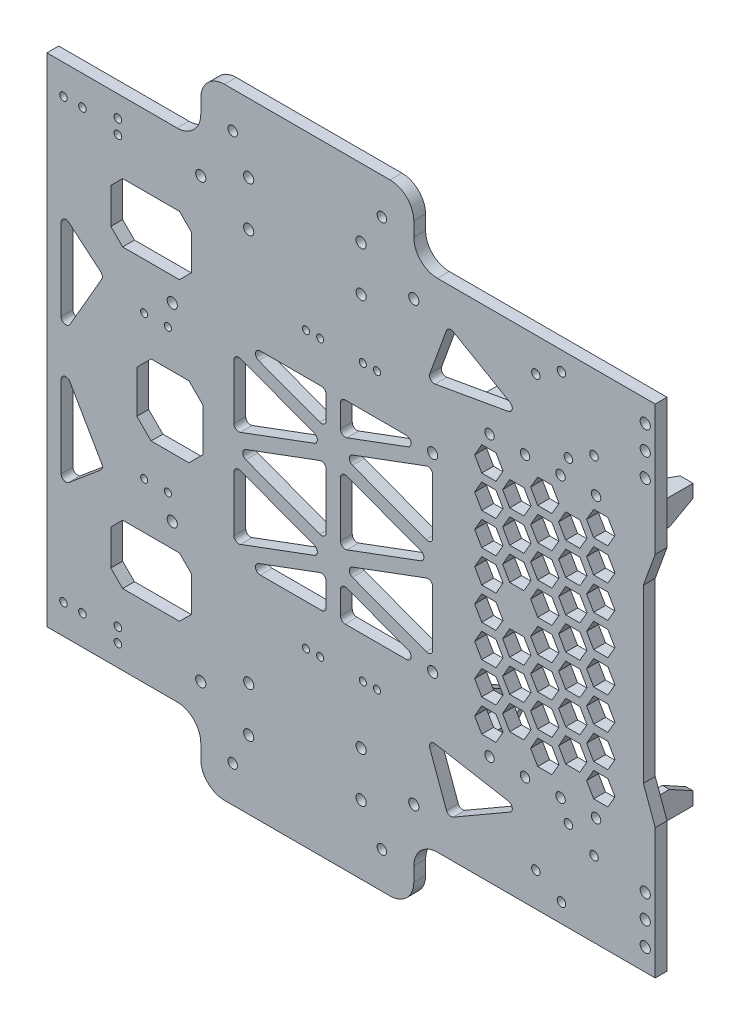
from build123d import *
from OCP.BRepFilletAPI import BRepFilletAPI_MakeChamfer

# Parameters (mm, degrees)
EXTRUDE_1_DEPTH              = 5
EXTRUDE_2_DEPTH              = 20
CHAMFER_2_SIZE               = 6
CHAMFER_2_SIZE2              = 3.19025659
CUT_EXTRUDE_3_DEPTH          = 10
CUT_EXTRUDE_4_DEPTH          = 10
CHAMFER_2_OF_MIRROR_1_SIZE   = 6
CHAMFER_2_OF_MIRROR_1_SIZE2  = 3.19025659
SKETCH_29_R                  = 2
CUT_EXTRUDE_12_DEPTH         = 10
CUT_EXTRUDE_5_DEPTH          = 5
OTHER_1_DEPTH                = 5
CUT_EXTRUDE_6_DEPTH          = 5
FILLET_2_R                   = 2
SKETCH_12_W                  = 10
SKETCH_12_H                  = 210
EXTRUDE_3_DEPTH              = 5
HOLE_WIZARD_M3_1_D           = 3.2
HOLE_WIZARD_M3_1_CBORE_D     = 5.9
HOLE_WIZARD_M3_1_CBORE_DEPTH = 1.6
SKETCH_10_R                  = 1.6
SKETCH_10_R_2                = 1.8
SKETCH_10_R_3                = 1.5
CUT_EXTRUDE_7_DEPTH          = 186.636742053
HOLE_WIZARD_2_D              = 4.3
HOLE_WIZARD_2_CSINK_D        = 7.5
HOLE_WIZARD_2_CSINK_ANGLE    = 90
HOLE_WIZARD_3_D              = 4.3
HOLE_WIZARD_3_CSINK_D        = 8
HOLE_WIZARD_3_CSINK_ANGLE    = 90
HOLE_WIZARD_1_D              = 4.3
HOLE_WIZARD_1_DEPTH          = 19
HOLE_WIZARD_1_CSINK_D        = 8
HOLE_WIZARD_1_CSINK_ANGLE    = 90
HOLE_WIZARD_1_TIP            = 1.291850331
SKETCH_14_R                  = 2
CUT_EXTRUDE_9_DEPTH          = 10
CUT_EXTRUDE_13_DEPTH         = 10
CUT_EXTRUDE_8_DEPTH          = 186.636742053
CUT_EXTRUDE_11_DEPTH         = 10
CUT_EXTRUDE_14_DEPTH         = 10
HOLE_WIZARD_4_D              = 4.3
HOLE_WIZARD_4_CSINK_D        = 5
HOLE_WIZARD_4_CSINK_ANGLE    = 90
SKETCH_36_W                  = 5
SKETCH_36_H                  = 100
CUT_EXTRUDE_15_DEPTH         = 10
CHAMFER_1_SIZE               = 13.737387097
CHAMFER_1_SIZE_2             = 5


# Read off the part's stored shape, not the designer's step: 镜向2, 填充阵列1
with BuildPart() as part:
    # 草图1 → 凸台-拉伸1 (new body)
    with BuildSketch(Plane.XY):
        with BuildLine():
            Line((-127, 105), (-127, 0))
            Line((-127, 0), (-127, -105))
            Line((-127, -105), (-126.91, -105))
            Line((-126.91, -105), (-72, -105))
            ThreePointArc((-72, -105), (-64.928932188, -107.928932188), (-62, -115))
            Line((-62, -115), (-62, -121))
            ThreePointArc((-62, -121), (-59.071067812, -128.071067812), (-52, -131))
            Line((-52, -131), (18, -131))
            ThreePointArc((18, -131), (25.071067812, -128.071067812), (28, -121))
            Line((28, -121), (28, -115))
            ThreePointArc((28, -115), (30.928932188, -107.928932188), (38, -105))
            Line((38, -105), (120, -105))
            ThreePointArc((120, -105), (127.071067812, -102.071067812), (130, -95))
            Line((130, -95), (130, 95))
            ThreePointArc((130, 95), (127.071067812, 102.071067812), (120, 105))
            Line((120, 105), (38, 105))
            ThreePointArc((38, 105), (30.928932188, 107.928932188), (28, 115))
            Line((28, 115), (28, 121))
            ThreePointArc((28, 121), (25.071067812, 128.071067812), (18, 131))
            Line((18, 131), (-52, 131))
            ThreePointArc((-52, 131), (-59.071067812, 128.071067812), (-62, 121))
            Line((-62, 121), (-62, 115))
            ThreePointArc((-62, 115), (-64.928932188, 107.928932188), (-72, 105))
            Line((-72, 105), (-126.91, 105))
            Line((-126.91, 105), (-127, 105))
        make_face()
    extrude(amount=EXTRUDE_1_DEPTH)

    # 草图4 → 凸台-拉伸2 (add)
    with BuildSketch(Plane(origin=(0, 0, 0), x_dir=(-1, 0, 0), z_dir=(0, 0, -1))):
        Polygon((-44, -48), (-44, -59), (-55, -59), (-55, -56), (-47, -56), (-47, -48), align=None)
    extrude_2 = extrude(amount=EXTRUDE_2_DEPTH)

    # 倒角2: one chamfer whose edges measure the first distance from different faces: ONE call of the kernel's chamfer builder (chamfer() names one face for all edges)
    chamfer_2_edges_1 = [part.edges().sort_by_distance(p)[0] for p in [
        (49.5, -59, 0),
    ]]
    chamfer_2_side_1 = [part.faces().sort_by_distance(p)[0] for p in [
        (49.5, -59, -10),
    ]]
    chamfer_2_edges_2 = [part.edges().sort_by_distance(p)[0] for p in [
        (44, -53.5, 0),
    ]]
    chamfer_2_side_2 = [part.faces().sort_by_distance(p)[0] for p in [
        (44, -53.5, -10),
    ]]
    chamfer_2 = BRepFilletAPI_MakeChamfer(part.part.solid().wrapped)
    for e in chamfer_2_edges_1:
        chamfer_2.Add(CHAMFER_2_SIZE, CHAMFER_2_SIZE2, e.wrapped, chamfer_2_side_1[0].wrapped)  # the first distance lies on this face
    for e in chamfer_2_edges_2:
        chamfer_2.Add(CHAMFER_2_SIZE, CHAMFER_2_SIZE2, e.wrapped, chamfer_2_side_2[0].wrapped)  # the first distance lies on this face
    add(Compound.cast(chamfer_2.Shape()), mode=Mode.REPLACE)

    # 草图5 → 切除-拉伸3 (cut)
    with BuildSketch(Plane.XZ.offset(59)):
        Polygon((55, -10), (49.5, -20), (55, -20), align=None)
    cut_extrude_3 = extrude(amount=-CUT_EXTRUDE_3_DEPTH, mode=Mode.SUBTRACT)

    # 草图6 → 切除-拉伸4 (cut)
    with BuildSketch(Plane.ZY.offset(-44)):
        Polygon((-20, -53.5), (-10, -48), (-20, -48), align=None)
    cut_extrude_4 = extrude(amount=-CUT_EXTRUDE_4_DEPTH, mode=Mode.SUBTRACT)

    # 镜向1: 凸台-拉伸2, 切除-拉伸3, 切除-拉伸4 across plane
    add(extrude_2.mirror(Plane(origin=(82.5, 0, 0), x_dir=(0, 0, 1), z_dir=(1, 0, 0))))
    add(cut_extrude_3.mirror(Plane(origin=(82.5, 0, 0), x_dir=(0, 0, 1), z_dir=(1, 0, 0))), mode=Mode.SUBTRACT)
    add(cut_extrude_4.mirror(Plane(origin=(82.5, 0, 0), x_dir=(0, 0, 1), z_dir=(1, 0, 0))), mode=Mode.SUBTRACT)

    # 倒角2 of 镜向1: one chamfer whose edges measure the first distance from different faces: ONE call of the kernel's chamfer builder (chamfer() names one face for all edges)
    chamfer_2_of_mirror_1_edges_1 = [part.edges().sort_by_distance(p)[0] for p in [
        (115.5, -59, 0),
    ]]
    chamfer_2_of_mirror_1_side_1 = [part.faces().sort_by_distance(p)[0] for p in [
        (115.5, -59, -10),
    ]]
    chamfer_2_of_mirror_1_edges_2 = [part.edges().sort_by_distance(p)[0] for p in [
        (121, -53.5, 0),
    ]]
    chamfer_2_of_mirror_1_side_2 = [part.faces().sort_by_distance(p)[0] for p in [
        (121, -53.5, -10),
    ]]
    chamfer_2_of_mirror_1 = BRepFilletAPI_MakeChamfer(part.part.solid().wrapped)
    for e in chamfer_2_of_mirror_1_edges_1:
        chamfer_2_of_mirror_1.Add(CHAMFER_2_OF_MIRROR_1_SIZE, CHAMFER_2_OF_MIRROR_1_SIZE2, e.wrapped, chamfer_2_of_mirror_1_side_1[0].wrapped)  # the first distance lies on this face
    for e in chamfer_2_of_mirror_1_edges_2:
        chamfer_2_of_mirror_1.Add(CHAMFER_2_OF_MIRROR_1_SIZE, CHAMFER_2_OF_MIRROR_1_SIZE2, e.wrapped, chamfer_2_of_mirror_1_side_2[0].wrapped)  # the first distance lies on this face
    add(Compound.cast(chamfer_2_of_mirror_1.Shape()), mode=Mode.REPLACE)

    # 镜向2: part across plane


with BuildPart() as part_1:
    add(part.part)
    add(part.part.mirror(Plane.ZX))

    # 草图29 → 切除-拉伸12 (cut)
    with BuildSketch(Plane(origin=(0, 0, 0), x_dir=(-1, 0, 0), z_dir=(0, 0, -1))):
        with Locations((-75, -59)):
            Circle(SKETCH_29_R)
        with Locations((-60, -59)):
            Circle(SKETCH_29_R)
        with Locations(Location((-105, -59, 0), (0, 0, 180))):
            Circle(SKETCH_29_R)
        with Locations(Location((-90, -59, 0), (0, 0, 180))):
            Circle(SKETCH_29_R)
        with Locations(Location((-60, 59, 0), (0, 0, 180))):
            Circle(SKETCH_29_R)
        with Locations(Location((-75, 59, 0), (0, 0, 180))):
            Circle(SKETCH_29_R)
        with Locations((-90, 59)):
            Circle(SKETCH_29_R)
        with Locations((-105, 59)):
            Circle(SKETCH_29_R)
    extrude(amount=-CUT_EXTRUDE_12_DEPTH, mode=Mode.SUBTRACT)

    # 草图7 → 切除-拉伸5 (cut)
    with BuildSketch(Plane(origin=(0, 0, 0), x_dir=(-1, 0, 0), z_dir=(0, 0, -1))):
        Polygon((-104, 43.107695155), (-101, 48.303847577), (-104, 53.5), (-110, 53.5), (-113, 48.303847577), (-110, 43.107695155), align=None)
    extrude(amount=-CUT_EXTRUDE_5_DEPTH, mode=Mode.SUBTRACT)

    # 填充阵列1 outline → 填充阵列1 (cut)
    with BuildSketch(Plane.XY):
        Polygon((53.715012953, 48.303847577), (56.715012953, 43.107695155), (62.715012953, 43.107695155), (65.715012953, 48.303847577), (62.715012953, 53.5), (56.715012953, 53.5), align=None)
        Polygon((77.357506477, 48.303847577), (80.357506477, 43.107695155), (86.357506477, 43.107695155), (89.357506477, 48.303847577), (86.357506477, 53.5), (80.357506477, 53.5), align=None)
        Polygon((92.178753238, 22.632695155), (98.178753238, 22.632695155), (101.178753238, 27.828847577), (98.178753238, 33.025), (92.178753238, 33.025), (89.178753238, 27.828847577), align=None)
        Polygon((80.357506477, 2.157695155), (86.357506477, 2.157695155), (89.357506477, 7.353847577), (86.357506477, 12.55), (80.357506477, 12.55), (77.357506477, 7.353847577), align=None)
        Polygon((56.715012953, -38.792304845), (62.715012953, -38.792304845), (65.715012953, -33.596152423), (62.715012953, -28.4), (56.715012953, -28.4), (53.715012953, -33.596152423), align=None)
        Polygon((68.536259715, -18.317304845), (74.536259715, -18.317304845), (77.536259715, -13.121152423), (74.536259715, -7.925), (68.536259715, -7.925), (65.536259715, -13.121152423), align=None)
        Polygon((74.536259715, 22.632695155), (77.536259715, 27.828847577), (74.536259715, 33.025), (68.536259715, 33.025), (65.536259715, 27.828847577), (68.536259715, 22.632695155), align=None)
        Polygon((110, -38.792304845), (113, -33.596152423), (110, -28.4), (104, -28.4), (101, -33.596152423), (104, -38.792304845), align=None)
        Polygon((98.178753238, -18.317304845), (101.178753238, -13.121152423), (98.178753238, -7.925), (92.178753238, -7.925), (89.178753238, -13.121152423), (92.178753238, -18.317304845), align=None)
        Polygon((77.357506477, -47.246152423), (80.357506477, -52.442304845), (86.357506477, -52.442304845), (89.357506477, -47.246152423), (86.357506477, -42.05), (80.357506477, -42.05), align=None)
        Polygon((101, -47.246152423), (104, -52.442304845), (110, -52.442304845), (113, -47.246152423), (110, -42.05), (104, -42.05), align=None)
        Polygon((53.715012953, -47.246152423), (56.715012953, -52.442304845), (62.715012953, -52.442304845), (65.715012953, -47.246152423), (62.715012953, -42.05), (56.715012953, -42.05), align=None)
        Polygon((92.178753238, -31.967304845), (98.178753238, -31.967304845), (101.178753238, -26.771152423), (98.178753238, -21.575), (92.178753238, -21.575), (89.178753238, -26.771152423), align=None)
        Polygon((104, -11.492304845), (110, -11.492304845), (113, -6.296152423), (110, -1.1), (104, -1.1), (101, -6.296152423), align=None)
        Polygon((62.715012953, -11.492304845), (65.715012953, -6.296152423), (62.715012953, -1.1), (56.715012953, -1.1), (53.715012953, -6.296152423), (56.715012953, -11.492304845), align=None)
        Polygon((74.536259715, -31.967304845), (77.536259715, -26.771152423), (74.536259715, -21.575), (68.536259715, -21.575), (65.536259715, -26.771152423), (68.536259715, -31.967304845), align=None)
        Polygon((89.178753238, -40.421152423), (92.178753238, -45.617304845), (98.178753238, -45.617304845), (101.178753238, -40.421152423), (98.178753238, -35.225), (92.178753238, -35.225), align=None)
        Polygon((65.536259715, -40.421152423), (68.536259715, -45.617304845), (74.536259715, -45.617304845), (77.536259715, -40.421152423), (74.536259715, -35.225), (68.536259715, -35.225), align=None)
        Polygon((104, -25.142304845), (110, -25.142304845), (113, -19.946152423), (110, -14.75), (104, -14.75), (101, -19.946152423), align=None)
        Polygon((62.715012953, 15.807695155), (65.715012953, 21.003847577), (62.715012953, 26.2), (56.715012953, 26.2), (53.715012953, 21.003847577), (56.715012953, 15.807695155), align=None)
        Polygon((86.357506477, -25.142304845), (89.357506477, -19.946152423), (86.357506477, -14.75), (80.357506477, -14.75), (77.357506477, -19.946152423), (80.357506477, -25.142304845), align=None)
        Polygon((74.536259715, 8.982695155), (77.536259715, 14.178847577), (74.536259715, 19.375), (68.536259715, 19.375), (65.536259715, 14.178847577), (68.536259715, 8.982695155), align=None)
        Polygon((62.715012953, 29.457695155), (65.715012953, 34.653847577), (62.715012953, 39.85), (56.715012953, 39.85), (53.715012953, 34.653847577), (56.715012953, 29.457695155), align=None)
        Polygon((86.357506477, -11.492304845), (89.357506477, -6.296152423), (86.357506477, -1.1), (80.357506477, -1.1), (77.357506477, -6.296152423), (80.357506477, -11.492304845), align=None)
        Polygon((89.178753238, 14.178847577), (92.178753238, 8.982695155), (98.178753238, 8.982695155), (101.178753238, 14.178847577), (98.178753238, 19.375), (92.178753238, 19.375), align=None)
        Polygon((80.357506477, 29.457695155), (86.357506477, 29.457695155), (89.357506477, 34.653847577), (86.357506477, 39.85), (80.357506477, 39.85), (77.357506477, 34.653847577), align=None)
        Polygon((53.715012953, 7.353847577), (56.715012953, 2.157695155), (62.715012953, 2.157695155), (65.715012953, 7.353847577), (62.715012953, 12.55), (56.715012953, 12.55), align=None)
        Polygon((101, 7.353847577), (104, 2.157695155), (110, 2.157695155), (113, 7.353847577), (110, 12.55), (104, 12.55), align=None)
        Polygon((86.357506477, -38.792304845), (89.357506477, -33.596152423), (86.357506477, -28.4), (80.357506477, -28.4), (77.357506477, -33.596152423), (80.357506477, -38.792304845), align=None)
        Polygon((77.357506477, 21.003847577), (80.357506477, 15.807695155), (86.357506477, 15.807695155), (89.357506477, 21.003847577), (86.357506477, 26.2), (80.357506477, 26.2), align=None)
        Polygon((101, 21.003847577), (104, 15.807695155), (110, 15.807695155), (113, 21.003847577), (110, 26.2), (104, 26.2), align=None)
        Polygon((92.178753238, 36.282695155), (98.178753238, 36.282695155), (101.178753238, 41.478847577), (98.178753238, 46.675), (92.178753238, 46.675), (89.178753238, 41.478847577), align=None)
        Polygon((56.715012953, -25.142304845), (62.715012953, -25.142304845), (65.715012953, -19.946152423), (62.715012953, -14.75), (56.715012953, -14.75), (53.715012953, -19.946152423), align=None)
        Polygon((74.536259715, 36.282695155), (77.536259715, 41.478847577), (74.536259715, 46.675), (68.536259715, 46.675), (65.536259715, 41.478847577), (68.536259715, 36.282695155), align=None)
        Polygon((98.178753238, -4.667304845), (101.178753238, 0.528847577), (98.178753238, 5.725), (92.178753238, 5.725), (89.178753238, 0.528847577), (92.178753238, -4.667304845), align=None)
        Polygon((104, 29.457695155), (110, 29.457695155), (113, 34.653847577), (110, 39.85), (104, 39.85), (101, 34.653847577), align=None)
    extrude(amount=OTHER_1_DEPTH, mode=Mode.SUBTRACT)

    # 草图9 → 切除-拉伸6 (cut)
    with BuildSketch(Plane(origin=(0, 0, 0), x_dir=(-1, 0, 0), z_dir=(0, 0, -1))):
        Polygon((3, 20.5), (-36, 35), (-36, 6), align=None)
        Polygon((3, 41), (-36, 41), (3, 26.5), align=None)
        Polygon((3, -14.5), (3, 14.5), (-36, 0), align=None)
        Polygon((-36, -6), (-36, -35), (3, -20.5), align=None)
        Polygon((-36, -41), (3, -41), (3, -26.5), align=None)
        Polygon((48, 41), (9, 41), (9, 26.5), align=None)
        Polygon((48, 6), (48, 35), (9, 20.5), align=None)
        Polygon((9, -26.5), (9, -41), (48, -41), align=None)
        Polygon((9, -20.5), (48, -35), (48, -6), align=None)
        Polygon((9, 14.5), (9, -14.5), (48, 0), align=None)
    extrude(amount=-CUT_EXTRUDE_6_DEPTH, mode=Mode.SUBTRACT)

    # 圆角2
    fillet_2_edges = [part_1.edges().sort_by_distance(p)[0] for p in [
        (-48, 35, 2.5),
        (-48, 6, 2.5),
        (-9, 20.5, 2.5),
        (-9, -41, 2.5),
        (-9, -26.5, 2.5),
        (-48, -41, 2.5),
        (36, -35, 2.5),
        (36, -6, 2.5),
        (-3, -20.5, 2.5),
        (-3, -41, 2.5),
        (36, -41, 2.5),
        (-3, -26.5, 2.5),
        (-48, -35, 2.5),
        (-9, -20.5, 2.5),
        (-48, -6, 2.5),
        (-9, 14.5, 2.5),
        (-48, 0, 2.5),
        (-9, -14.5, 2.5),
        (-3, 20.5, 2.5),
        (36, 6, 2.5),
        (36, 35, 2.5),
        (-3, 26.5, 2.5),
        (36, 41, 2.5),
        (-3, 41, 2.5),
        (-9, 41, 2.5),
        (-48, 41, 2.5),
        (-9, 26.5, 2.5),
        (-3, -14.5, 2.5),
        (36, 0, 2.5),
        (-3, 14.5, 2.5),
    ]]
    fillet(fillet_2_edges, radius=FILLET_2_R)

    # 草图12 → 凸台-拉伸3 (add)
    with BuildSketch(Plane(origin=(0, 0, 0), x_dir=(-1, 0, 0), z_dir=(0, 0, -1))):
        with Locations((-125, 0)):
            Rectangle(SKETCH_12_W, SKETCH_12_H)
    extrude(amount=-EXTRUDE_3_DEPTH)

    # M3 六角头螺栓的柱形沉头孔1 (through all)
    with Locations(Plane(origin=(-124.363861944, -131.010130877, -4.2), x_dir=(0, 1, 0), z_dir=(0, 0, -1))):
        with Locations((221.010130877, 27.363861944), (227.010130877, 27.363861944)):
            CounterBoreHole(HOLE_WIZARD_M3_1_D / 2, HOLE_WIZARD_M3_1_CBORE_D / 2, HOLE_WIZARD_M3_1_CBORE_DEPTH)

    # 草图10 → 切除-拉伸7 (cut, through all)
    with BuildSketch(Plane(origin=(0, 0, 0), x_dir=(-1, 0, 0), z_dir=(0, 0, -1))):
        with Locations((112, 92.5)):
            Circle(SKETCH_10_R)
        with Locations((120, 92.5)):
            Circle(SKETCH_10_R)
        with Locations(Location((120, -92.5, 0), (0, 0, 180))):
            Circle(SKETCH_10_R)
        with Locations(Location((112, -92.5, 0), (0, 0, 180))):
            Circle(SKETCH_10_R)
        with Locations((-104.142304845, 73.184301396)):
            Circle(SKETCH_10_R_2)
        with Locations((-93.316987298, 66.934301396)):
            Circle(SKETCH_10_R_2)
        with Locations((-90.392304845, 97)):
            Circle(SKETCH_10_R_2)
        with Locations((-79.566987298, 90.75)):
            Circle(SKETCH_10_R_2)
        with Locations(Location((-79.566987298, -90.75, 0), (0, 0, 180))):
            Circle(SKETCH_10_R_2)
        with Locations(Location((-90.392304845, -97, 0), (0, 0, 180))):
            Circle(SKETCH_10_R_2)
        with Locations(Location((-93.316987298, -66.934301396, 0), (0, 0, 180))):
            Circle(SKETCH_10_R_2)
        with Locations(Location((-104.142304845, -73.184301396, 0), (0, 0, 180))):
            Circle(SKETCH_10_R_2)
        with Locations((-12.457142988, 58.25)):
            Circle(SKETCH_10_R_3)
        with Locations((-6.457142988, 58.25)):
            Circle(SKETCH_10_R_3)
        with Locations((11.542857012, 58.25)):
            Circle(SKETCH_10_R_3)
        with Locations((17.542857012, 58.25)):
            Circle(SKETCH_10_R_3)
        with Locations(Location((17.542857012, -58.25, 0), (0, 0, 180))):
            Circle(SKETCH_10_R_3)
        with Locations(Location((11.542857012, -58.25, 0), (0, 0, 180))):
            Circle(SKETCH_10_R_3)
        with Locations(Location((-6.457142988, -58.25, 0), (0, 0, 180))):
            Circle(SKETCH_10_R_3)
        with Locations(Location((-12.457142988, -58.25, 0), (0, 0, 180))):
            Circle(SKETCH_10_R_3)
        with Locations(Location((97, 96, 0), (0, 0, 90))):
            Circle(SKETCH_10_R)
        with Locations(Location((97, 90, 0), (0, 0, 90))):
            Circle(SKETCH_10_R)
        with Locations(Location((97, -90, 0), (0, 0, 180))):
            Circle(SKETCH_10_R)
        with Locations(Location((97, -96, 0), (0, 0, 180))):
            Circle(SKETCH_10_R)
        with Locations((75.896950208, 30.3)):
            Circle(SKETCH_10_R_3)
        with Locations((85.896950208, 30.3)):
            Circle(SKETCH_10_R_3)
        with Locations(Location((85.896950208, -30.3, 0), (0, 0, 180))):
            Circle(SKETCH_10_R_3)
        with Locations(Location((75.896950208, -30.3, 0), (0, 0, 180))):
            Circle(SKETCH_10_R_3)
    extrude(amount=-CUT_EXTRUDE_7_DEPTH, mode=Mode.SUBTRACT)

    # 打孔尺寸(%根据十字)槽半沉头木螺钉的类型2 (through all)
    with Locations(Plane(origin=(-40.491378875, -131.010130877, 55.5), x_dir=(0, -1, 0), z_dir=(0, 0, 1))):
        with Locations((-171.010130877, 76.446187472), (-91.010130877, 76.446187472), (-171.010130877, -33.553812528), (-91.010130877, -33.553812528)):
            CounterSinkHole(HOLE_WIZARD_2_D / 2, HOLE_WIZARD_2_CSINK_D / 2, counter_sink_angle=HOLE_WIZARD_2_CSINK_ANGLE)

    # 打孔尺寸(%根据十字)槽半沉头木螺钉的类型3 (through all)
    with Locations(Plane(origin=(-40.491378875, -131.010130877, 55.5), x_dir=(0, -1, 0), z_dir=(0, 0, 1))):
        with Locations((-38.510130877, 68.491378875), (-38.510130877, -21.508621125), (-223.510130877, -21.508621125), (-223.510130877, 68.491378875)):
            CounterSinkHole(HOLE_WIZARD_3_D / 2, HOLE_WIZARD_3_CSINK_D / 2, counter_sink_angle=HOLE_WIZARD_3_CSINK_ANGLE)

    # 打孔尺寸(%根据十字)槽沉头木螺钉的类型1
    with Locations(Plane(origin=(-40.491378875, -131.010130877, -7.000000001), x_dir=(0, 1, 0), z_dir=(0, 0, -1))):
        with Locations((35.241437657, 166.27295648), (45.241437657, 166.27295648), (55.241437657, 166.27295648), (206.778824098, 166.27295648), (216.778824098, 166.27295648), (226.778824098, 166.27295648)):
            CounterSinkHole(HOLE_WIZARD_1_D / 2, HOLE_WIZARD_1_CSINK_D / 2, depth=HOLE_WIZARD_1_DEPTH, counter_sink_angle=HOLE_WIZARD_1_CSINK_ANGLE)
            with Locations((0, 0, -(HOLE_WIZARD_1_DEPTH + HOLE_WIZARD_1_TIP / 2))):  # 118° drill point
                Cone(0, HOLE_WIZARD_1_D / 2, HOLE_WIZARD_1_TIP, mode=Mode.SUBTRACT)

    # 草图14 → 切除-拉伸9 (cut)
    with BuildSketch(Plane.XY.offset(5)):
        with Locations((14.5, -115.68)):
            Circle(SKETCH_14_R)
        with Locations((-48.5, -115.68)):
            Circle(SKETCH_14_R)
        with Locations((-48.5, 115.68)):
            Circle(SKETCH_14_R)
        with Locations((14.5, 115.68)):
            Circle(SKETCH_14_R)
    extrude(amount=-CUT_EXTRUDE_9_DEPTH, mode=Mode.SUBTRACT)

    # 草图31 → 切除-拉伸13 (cut)
    with BuildSketch(Plane(origin=(0, 0, 0), x_dir=(-1, 0, 0), z_dir=(0, 0, -1))):
        with BuildLine():
            Line((103.839099631, -33.759449727), (117.267949192, -10.5))
            ThreePointArc((117.267949192, -10.5), (119.51763809, -9.568148347), (121, -11.5))
            Line((121, -11.5), (121, -46.027592441))
            ThreePointArc((121, -46.027592441), (119.845236523, -47.840208015), (117.714424781, -47.559681328))
            Line((117.714424781, -47.559681328), (104.285575219, -36.291538614))
            ThreePointArc((104.285575219, -36.291538614), (103.601534933, -35.106746083), (103.839099631, -33.759449727))
        make_face()
        with BuildLine():
            Line((121, 11.5), (121, 46.027592441))
            ThreePointArc((121, 46.027592441), (119.845236523, 47.840208015), (117.714424781, 47.559681328))
            Line((117.714424781, 47.559681328), (104.285575219, 36.291538614))
            ThreePointArc((104.285575219, 36.291538614), (103.601534933, 35.106746083), (103.839099631, 33.759449727))
            Line((103.839099631, 33.759449727), (117.267949192, 10.5))
            ThreePointArc((117.267949192, 10.5), (119.51763809, 9.568148347), (121, 11.5))
        make_face()
    extrude(amount=-CUT_EXTRUDE_13_DEPTH, mode=Mode.SUBTRACT)

    # 草图11 → 切除-拉伸8 (cut, through all)
    with BuildSketch(Plane(origin=(0, 0, 0), x_dir=(-1, 0, 0), z_dir=(0, 0, -1))):
        Polygon((71, -75), (95, -75), (100, -70), (100, -55), (95, -50), (71, -50), (66, -55), (66, -70), align=None)
        Polygon((95, 75), (100, 70), (100, 55), (95, 50), (71, 50), (66, 55), (66, 70), (71, 75), align=None)
    extrude(amount=-CUT_EXTRUDE_8_DEPTH, mode=Mode.SUBTRACT)

    # 草图18 → 切除-拉伸11 (cut)
    with BuildSketch(Plane.XY.offset(5)):
        Polygon((-89, 9), (-83, 15), (-67, 15), (-61, 9), (-61, -9), (-67, -15), (-83, -15), (-89, -9), align=None)
    extrude(amount=-CUT_EXTRUDE_11_DEPTH, mode=Mode.SUBTRACT)

    # 草图32 → 切除-拉伸14 (cut)
    with BuildSketch(Plane.XY.offset(5)):
        with BuildLine():
            Line((68.615081359, -74.977511711), (44.659546159, -88.808246407))
            ThreePointArc((44.659546159, -88.808246407), (42.975505873, -88.955580841), (41.780160918, -87.760235886))
            Line((41.780160918, -87.760235886), (34.758112882, -68.467317469))
            ThreePointArc((34.758112882, -68.467317469), (35.105409237, -66.497701963), (36.984794479, -65.813661676))
            Line((36.984794479, -65.813661676), (67.962377714, -71.275845398))
            ThreePointArc((67.962377714, -71.275845398), (69.584696865, -72.898164549), (68.615081359, -74.977511711))
        make_face()
        with BuildLine():
            Line((41.780160918, 87.760235886), (34.758112882, 68.467317469))
            ThreePointArc((34.758112882, 68.467317469), (35.105409237, 66.497701963), (36.984794479, 65.813661676))
            Line((36.984794479, 65.813661676), (67.962377714, 71.275845398))
            ThreePointArc((67.962377714, 71.275845398), (69.584696865, 72.898164549), (68.615081359, 74.977511711))
            Line((68.615081359, 74.977511711), (44.659546159, 88.808246407))
            ThreePointArc((44.659546159, 88.808246407), (42.975505873, 88.955580841), (41.780160918, 87.760235886))
        make_face()
    extrude(amount=-CUT_EXTRUDE_14_DEPTH, mode=Mode.SUBTRACT)

    # 打孔尺寸(%根据十字)槽半沉头木螺钉的类型4 (through all)
    with Locations(Plane(origin=(-124.363861944, -131.010130877, -5), x_dir=(0, 1, 0), z_dir=(0, 0, -1))):
        with Locations((233.010130877, 130.113861944), (214.010130877, 130.113861944), (214.010130877, 82.613861944), (233.010130877, 82.613861944), (48.010130877, 82.613861944), (29.010130877, 82.613861944), (29.010130877, 130.113861944), (48.010130877, 130.113861944)):
            CounterSinkHole(HOLE_WIZARD_4_D / 2, HOLE_WIZARD_4_CSINK_D / 2, counter_sink_angle=HOLE_WIZARD_4_CSINK_ANGLE)

    # 草图36 → 切除-拉伸15 (cut)
    with BuildSketch(Plane(origin=(0, 0, 0), x_dir=(-1, 0, 0), z_dir=(0, 0, -1))):
        with Locations((-127.5, 0)):
            Rectangle(SKETCH_36_W, SKETCH_36_H)
    extrude(amount=-CUT_EXTRUDE_15_DEPTH, mode=Mode.SUBTRACT)

    # 倒角1
    chamfer_1_edges_1 = [part_1.edges().sort_by_distance(p)[0] for p in [
        (125, -50, 2.5),
    ]]
    chamfer_1_side_1 = [part_1.faces().sort_by_distance(p)[0] for p in [
        (125, -49.9, 2.5),
    ]]
    chamfer_1_edges_2 = [part_1.edges().sort_by_distance(p)[0] for p in [
        (125, 50, 2.5),
    ]]
    chamfer_1_side_2 = [part_1.faces().sort_by_distance(p)[0] for p in [
        (125.1, 50, 2.5),
    ]]
    chamfer_1 = BRepFilletAPI_MakeChamfer(part_1.part.solid().wrapped)
    for e in chamfer_1_edges_1:
        chamfer_1.Add(CHAMFER_1_SIZE - 0.0001, CHAMFER_1_SIZE_2 - 0.0001, e.wrapped, chamfer_1_side_1[0].wrapped)
    for e in chamfer_1_edges_2:
        chamfer_1.Add(CHAMFER_1_SIZE_2 - 0.0001, CHAMFER_1_SIZE - 0.0001, e.wrapped, chamfer_1_side_2[0].wrapped)
    add(Compound.cast(chamfer_1.Shape()), mode=Mode.REPLACE)  # a hair under: the kernel refuses the full size


solid = part_1.part
